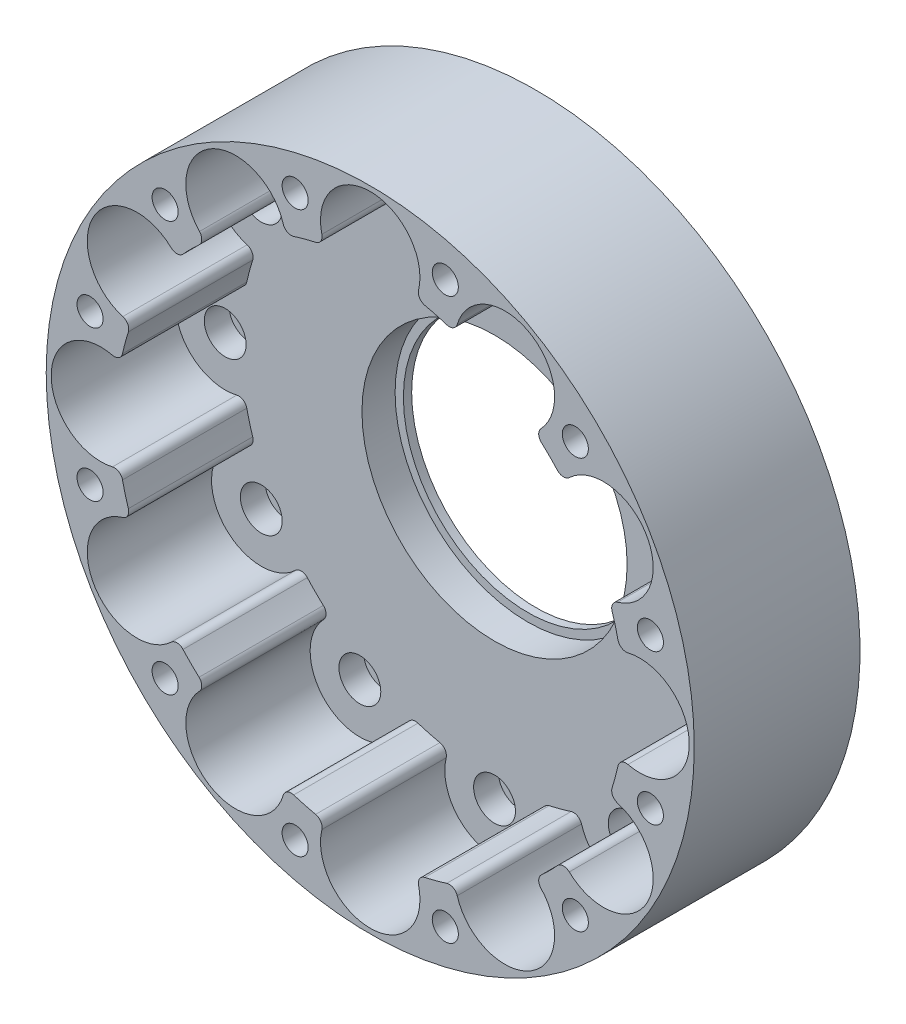
from build123d import *
from build123d.topology import SkipClean

# Parameters (mm, degrees)
SKETCH1_R           = 39.1
SKETCH1_R_2         = 2.525
SKETCH1_R_3         = 16
BOSS_EXTRUDE1_DEPTH = 3
BOSS_EXTRUDE2_START = 2
SKETCH2_R           = 39.1
SKETCH2_R_2         = 16
BOSS_EXTRUDE2_DEPTH = 2
SKETCH4_R           = 16
SKETCH4_R_2         = 15
BOSS_EXTRUDE3_DEPTH = 1
SKETCH5_R           = 39.1
BOSS_EXTRUDE4_DEPTH = 15
FILLET2_R           = 1
SKETCH7_R           = 1.575
CUT_EXTRUDE1_DEPTH  = 59.801530759
CUT_EXTRUDE3_DEPTH  = 3


with BuildPart() as part:
    # Sketch1 → Boss-Extrude1 (new body)
    with BuildSketch(Plane.XY):
        Circle(SKETCH1_R)
        with Locations((32.5, 0)):
            Circle(SKETCH1_R_2, mode=Mode.SUBTRACT)
        with Locations((28.145825623, -16.25)):
            Circle(SKETCH1_R_2, mode=Mode.SUBTRACT)
        with Locations((16.25, -28.145825623)):
            Circle(SKETCH1_R_2, mode=Mode.SUBTRACT)
        with Locations((0, -32.5)):
            Circle(SKETCH1_R_2, mode=Mode.SUBTRACT)
        with Locations((-16.25, -28.145825623)):
            Circle(SKETCH1_R_2, mode=Mode.SUBTRACT)
        with Locations((-28.145825623, -16.25)):
            Circle(SKETCH1_R_2, mode=Mode.SUBTRACT)
        with Locations((-32.5, 0)):
            Circle(SKETCH1_R_2, mode=Mode.SUBTRACT)
        with Locations((-28.145825623, 16.25)):
            Circle(SKETCH1_R_2, mode=Mode.SUBTRACT)
        with Locations((-16.25, 28.145825623)):
            Circle(SKETCH1_R_2, mode=Mode.SUBTRACT)
        with Locations((0, 32.5)):
            Circle(SKETCH1_R_2, mode=Mode.SUBTRACT)
        with Locations((16.25, 28.145825623)):
            Circle(SKETCH1_R_2, mode=Mode.SUBTRACT)
        Circle(SKETCH1_R_3, mode=Mode.SUBTRACT)
        with Locations((28.145825623, 16.25)):
            Circle(SKETCH1_R_2, mode=Mode.SUBTRACT)
    extrude(amount=BOSS_EXTRUDE1_DEPTH)

    # Sketch2 → Boss-Extrude2 (add)
    with BuildSketch(Plane(origin=(0, 0, 0), x_dir=(-1, 0, 0), z_dir=(0, 0, -1)).offset(BOSS_EXTRUDE2_START)):
        Circle(SKETCH2_R)
        Circle(SKETCH2_R_2, mode=Mode.SUBTRACT)
    extrude(amount=-BOSS_EXTRUDE2_DEPTH)

    # Sketch4 → Boss-Extrude3 (add)
    with SkipClean():  # the faces are left unmerged after this step: merging them gives an invalid solid
        with BuildSketch(Plane(origin=(0, 0, -2), x_dir=(-1, 0, 0), z_dir=(0, 0, -1))):
            Circle(SKETCH4_R)
            Circle(SKETCH4_R_2, mode=Mode.SUBTRACT)
        extrude(amount=-BOSS_EXTRUDE3_DEPTH)

    # Sketch5 → Boss-Extrude4 (add)
    with BuildSketch(Plane.XY.offset(3)):
        Circle(SKETCH5_R)
        with BuildLine():
            ThreePointArc((-19.822264007, 23.325148299), (-19.25, 33.341978046), (-10.28903897, 28.82915834))
            ThreePointArc((-10.28903897, 28.82915834), (-7.922504212, 29.567188242), (-5.504010041, 30.111302977))
            ThreePointArc((-5.504010041, 30.111302977), (0, 38.5), (5.504010041, 30.111302977))
            ThreePointArc((5.504010041, 30.111302977), (7.922504212, 29.567188242), (10.28903897, 28.82915834))
            ThreePointArc((10.28903897, 28.82915834), (19.25, 33.341978046), (19.822264007, 23.325148299))
            ThreePointArc((19.822264007, 23.325148299), (21.64468403, 21.64468403), (23.325148299, 19.822264007))
            ThreePointArc((23.325148299, 19.822264007), (33.341978046, 19.25), (28.82915834, 10.28903897))
            ThreePointArc((28.82915834, 10.28903897), (29.567188242, 7.922504212), (30.111302977, 5.504010041))
            ThreePointArc((30.111302977, 5.504010041), (38.5, 0), (30.111302977, -5.504010041))
            ThreePointArc((30.111302977, -5.504010041), (29.567188242, -7.922504212), (28.82915834, -10.28903897))
            ThreePointArc((28.82915834, -10.28903897), (33.341978046, -19.25), (23.325148299, -19.822264007))
            ThreePointArc((23.325148299, -19.822264007), (21.64468403, -21.64468403), (19.822264007, -23.325148299))
            ThreePointArc((19.822264007, -23.325148299), (19.25, -33.341978046), (10.28903897, -28.82915834))
            ThreePointArc((10.28903897, -28.82915834), (7.922504212, -29.567188242), (5.504010041, -30.111302977))
            ThreePointArc((5.504010041, -30.111302977), (0, -38.5), (-5.504010041, -30.111302977))
            ThreePointArc((-5.504010041, -30.111302977), (-7.922504212, -29.567188242), (-10.28903897, -28.82915834))
            ThreePointArc((-10.28903897, -28.82915834), (-19.25, -33.341978046), (-19.822264007, -23.325148299))
            ThreePointArc((-19.822264007, -23.325148299), (-21.64468403, -21.64468403), (-23.325148299, -19.822264007))
            ThreePointArc((-23.325148299, -19.822264007), (-33.341978046, -19.25), (-28.82915834, -10.28903897))
            ThreePointArc((-28.82915834, -10.28903897), (-29.567188242, -7.922504212), (-30.111302977, -5.504010041))
            ThreePointArc((-30.111302977, -5.504010041), (-38.5, 0), (-30.111302977, 5.504010041))
            ThreePointArc((-30.111302977, 5.504010041), (-29.567188242, 7.922504212), (-28.82915834, 10.28903897))
            ThreePointArc((-28.82915834, 10.28903897), (-33.341978046, 19.25), (-23.325148299, 19.822264007))
            ThreePointArc((-23.325148299, 19.822264007), (-21.64468403, 21.64468403), (-19.822264007, 23.325148299))
        make_face(mode=Mode.SUBTRACT)
    extrude(amount=BOSS_EXTRUDE4_DEPTH)

    # Fillet2
    fillet2_edges = [part.edges().sort_by_distance(p)[0] for p in [
        (10.28903897, -28.82915834, 10.5),
        (5.504010041, -30.111302977, 10.5),
        (30.111302977, -5.504010041, 10.5),
        (28.82915834, -10.28903897, 10.5),
        (23.325148299, -19.822264007, 10.5),
        (19.822264007, -23.325148299, 10.5),
        (-10.28903897, -28.82915834, 10.5),
        (-5.504010041, -30.111302977, 10.5),
        (-19.822264007, -23.325148299, 10.5),
        (-23.325148299, -19.822264007, 10.5),
        (-30.111302977, -5.504010041, 10.5),
        (-28.82915834, -10.28903897, 10.5),
        (-19.822264007, 23.325148299, 10.5),
        (30.111302977, 5.504010041, 10.5),
        (28.82915834, 10.28903897, 10.5),
        (23.325148299, 19.822264007, 10.5),
        (19.822264007, 23.325148299, 10.5),
        (10.28903897, 28.82915834, 10.5),
        (5.504010041, 30.111302977, 10.5),
        (-5.504010041, 30.111302977, 10.5),
        (-10.28903897, 28.82915834, 10.5),
        (-30.111302977, 5.504010041, 10.5),
        (-28.82915834, 10.28903897, 10.5),
        (-23.325148299, 19.822264007, 10.5),
    ]]
    fillet(fillet2_edges, radius=FILLET2_R)

    # Sketch7 → Cut-Extrude1 (cut, through all)
    with BuildSketch(Plane(origin=(0, 0, -2), x_dir=(-1, 0, 0), z_dir=(0, 0, -1))):
        with Locations((33.80740392, -9.058666579)):
            Circle(SKETCH7_R)
        with Locations((24.748737342, -24.748737342)):
            Circle(SKETCH7_R)
        with Locations((9.058666579, -33.80740392)):
            Circle(SKETCH7_R)
        with Locations((-9.058666579, -33.80740392)):
            Circle(SKETCH7_R)
        with Locations((-24.748737342, -24.748737342)):
            Circle(SKETCH7_R)
        with Locations((-33.80740392, -9.058666579)):
            Circle(SKETCH7_R)
        with Locations((-33.80740392, 9.058666579)):
            Circle(SKETCH7_R)
        with Locations((-24.748737342, 24.748737342)):
            Circle(SKETCH7_R)
        with Locations((-9.058666579, 33.80740392)):
            Circle(SKETCH7_R)
        with Locations((9.058666579, 33.80740392)):
            Circle(SKETCH7_R)
        with Locations((24.748737342, 24.748737342)):
            Circle(SKETCH7_R)
        with Locations((33.80740392, 9.058666579)):
            Circle(SKETCH7_R)
    extrude(amount=-CUT_EXTRUDE1_DEPTH, mode=Mode.SUBTRACT)

    # Sketch8 → Cut-Extrude3 (cut)
    with BuildSketch(Plane(origin=(0, 0, -2), x_dir=(-1, 0, 0), z_dir=(0, 0, -1))):
        Polygon((27.598737342, -26.394185609), (27.598737342, -23.103289074), (24.748737342, -21.457840807), (21.898737342, -23.103289074), (21.898737342, -26.394185609), (24.748737342, -28.039633876), align=None)
        Polygon((37.098300454, -9.058666579), (35.452852187, -6.208666579), (32.161955653, -6.208666579), (30.516507386, -9.058666579), (32.161955653, -11.908666579), (35.452852187, -11.908666579), align=None)
        Polygon((10.704114846, -36.65740392), (12.349563113, -33.80740392), (10.704114846, -30.95740392), (7.413218311, -30.95740392), (5.767770044, -33.80740392), (7.413218311, -36.65740392), align=None)
        Polygon((-9.058666579, -37.098300454), (-6.208666579, -35.452852187), (-6.208666579, -32.161955653), (-9.058666579, -30.516507386), (-11.908666579, -32.161955653), (-11.908666579, -35.452852187), align=None)
        Polygon((-26.394185609, -27.598737342), (-23.103289074, -27.598737342), (-21.457840807, -24.748737342), (-23.103289074, -21.898737342), (-26.394185609, -21.898737342), (-28.039633876, -24.748737342), align=None)
        Polygon((-36.65740392, -10.704114846), (-33.80740392, -12.349563113), (-30.95740392, -10.704114846), (-30.95740392, -7.413218311), (-33.80740392, -5.767770044), (-36.65740392, -7.413218311), align=None)
        Polygon((-37.098300454, 9.058666579), (-35.452852187, 6.208666579), (-32.161955653, 6.208666579), (-30.516507386, 9.058666579), (-32.161955653, 11.908666579), (-35.452852187, 11.908666579), align=None)
        Polygon((-27.598737342, 26.394185609), (-27.598737342, 23.103289074), (-24.748737342, 21.457840807), (-21.898737342, 23.103289074), (-21.898737342, 26.394185609), (-24.748737342, 28.039633876), align=None)
        Polygon((-10.704114846, 36.65740392), (-12.349563113, 33.80740392), (-10.704114846, 30.95740392), (-7.413218311, 30.95740392), (-5.767770044, 33.80740392), (-7.413218311, 36.65740392), align=None)
        Polygon((9.058666579, 37.098300454), (6.208666579, 35.452852187), (6.208666579, 32.161955653), (9.058666579, 30.516507386), (11.908666579, 32.161955653), (11.908666579, 35.452852187), align=None)
        Polygon((26.394185609, 27.598737342), (23.103289074, 27.598737342), (21.457840807, 24.748737342), (23.103289074, 21.898737342), (26.394185609, 21.898737342), (28.039633876, 24.748737342), align=None)
        Polygon((36.65740392, 10.704114846), (33.80740392, 12.349563113), (30.95740392, 10.704114846), (30.95740392, 7.413218311), (33.80740392, 5.767770044), (36.65740392, 7.413218311), align=None)
    extrude(amount=-CUT_EXTRUDE3_DEPTH, mode=Mode.SUBTRACT)


solid = part.part
